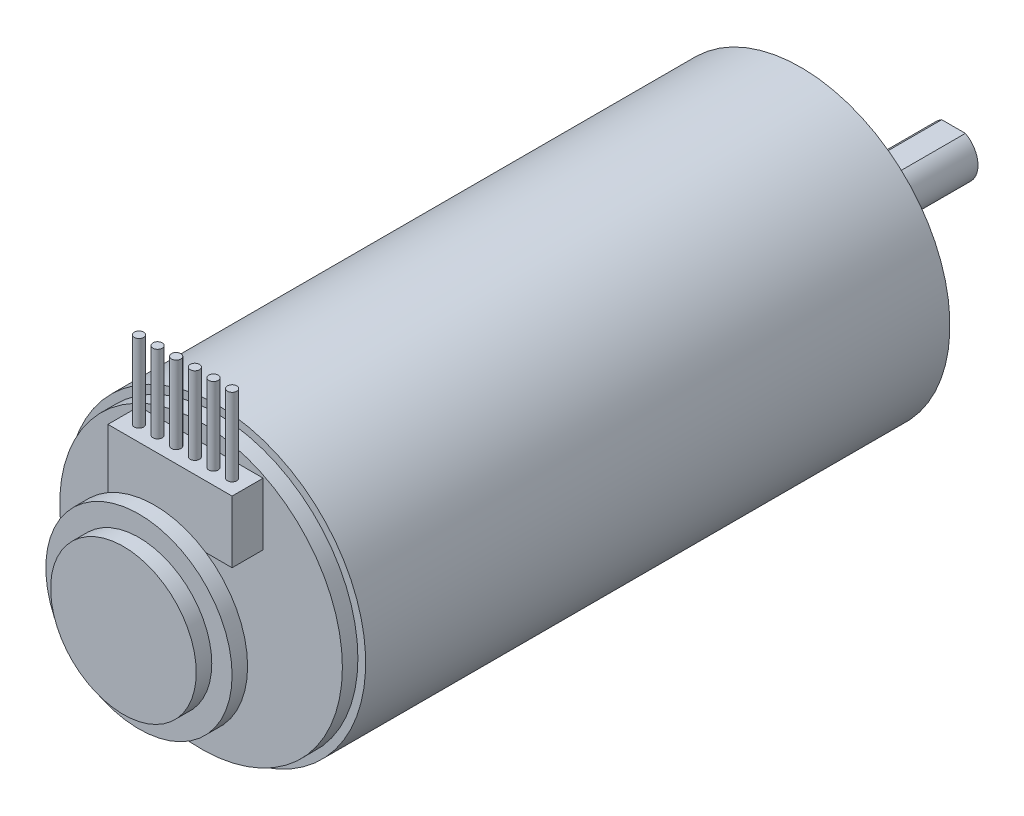
from build123d import *

# Parameters (mm, degrees)
SKETCH1_R            = 2
BOSS_EXTRUDE1_DEPTH  = 10
SKETCH2_R            = 3.5
BOSS_EXTRUDE2_DEPTH  = 2.5
SKETCH3_W            = 7.249397338
SKETCH3_H            = 0.762
CUT_EXTRUDE1_DEPTH   = 8
SKETCH4_R            = 12.2
BOSS_EXTRUDE3_DEPTH  = 47.8
SKETCH5_R            = 11.565
BOSS_EXTRUDE4_DEPTH  = 1.27
BOSS_EXTRUDE5_START  = 5.08
SKETCH6_W            = 10.16
SKETCH6_H            = 2.54
BOSS_EXTRUDE5_DEPTH  = 5.08
SKETCH8_R            = 1.27
BOSS_EXTRUDE8_DEPTH  = 3.81
SKETCH9_R            = 7.62
BOSS_EXTRUDE9_DEPTH  = 1.27
SKETCH10_R           = 5.957710943
BOSS_EXTRUDE10_DEPTH = 1.27
SKETCH11_R           = 0.381
BOSS_EXTRUDE12_DEPTH = 6.35


with BuildPart() as part:
    # Sketch1 → Boss-Extrude1 (new body)
    with BuildSketch(Plane.XY):
        Circle(SKETCH1_R)
    extrude(amount=BOSS_EXTRUDE1_DEPTH)

    # Sketch2 → Boss-Extrude2 (add)
    with BuildSketch(Plane.XY.offset(10)):
        Circle(SKETCH2_R)
    extrude(amount=BOSS_EXTRUDE2_DEPTH)

    # Sketch3 → Cut-Extrude1 (cut)
    with BuildSketch(Plane(origin=(0, 0, 0), x_dir=(-1, 0, 0), z_dir=(0, 0, -1))):
        with Locations((0, 2.131)):
            Rectangle(SKETCH3_W, SKETCH3_H)
    extrude(amount=-CUT_EXTRUDE1_DEPTH, mode=Mode.SUBTRACT)

    # Sketch4 → Boss-Extrude3 (add)
    with BuildSketch(Plane.XY.offset(12.5)):
        Circle(SKETCH4_R)
    extrude(amount=BOSS_EXTRUDE3_DEPTH)

    # Sketch5 → Boss-Extrude4 (add)
    with BuildSketch(Plane.XY.offset(60.3)):
        Circle(SKETCH5_R)
    extrude(amount=BOSS_EXTRUDE4_DEPTH)

    # Sketch6 → Boss-Extrude5 (add)
    with BuildSketch(Plane(origin=(0, 0, 0), x_dir=(1, 0, 0), z_dir=(0, 1, 0)).offset(BOSS_EXTRUDE5_START)):
        with Locations((0, -62.84)):
            Rectangle(SKETCH6_W, SKETCH6_H)
    extrude(amount=BOSS_EXTRUDE5_DEPTH)

    # Sketch8 → Boss-Extrude8 (add)
    with BuildSketch(Plane.XY.offset(61.57)):
        Circle(SKETCH8_R)
    extrude(amount=BOSS_EXTRUDE8_DEPTH)

    # Sketch9 → Boss-Extrude9 (add)
    with BuildSketch(Plane.XY.offset(65.38)):
        Circle(SKETCH9_R)
    extrude(amount=BOSS_EXTRUDE9_DEPTH)

    # Sketch10 → Boss-Extrude10 (add)
    with BuildSketch(Plane.XY.offset(66.65)):
        Circle(SKETCH10_R)
    extrude(amount=BOSS_EXTRUDE10_DEPTH)

    # Sketch11 → Boss-Extrude12 (add)
    with BuildSketch(Plane(origin=(0, 10.16, 0), x_dir=(1, 0, 0), z_dir=(0, 1, 0))):
        with Locations((-0.762, -62.84)):
            Circle(SKETCH11_R)
        with Locations((-2.286, -62.84)):
            Circle(SKETCH11_R)
        with Locations((-3.81, -62.84)):
            Circle(SKETCH11_R)
        with Locations((0.762, -62.84)):
            Circle(SKETCH11_R)
        with Locations((2.286, -62.84)):
            Circle(SKETCH11_R)
        with Locations((3.81, -62.84)):
            Circle(SKETCH11_R)
    extrude(amount=BOSS_EXTRUDE12_DEPTH)


solid = part.part
